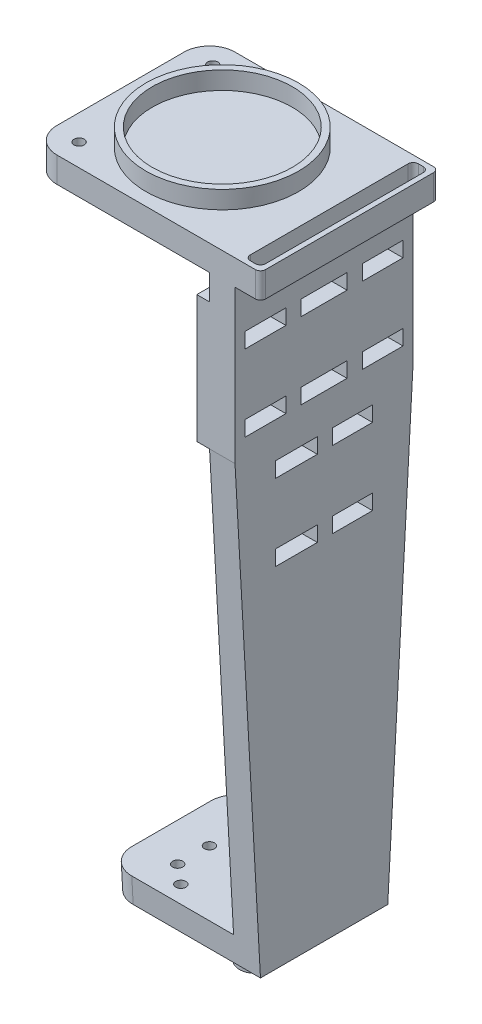
from build123d import *

# Parameters (mm, degrees)
SKETCH1_W                 = 80
SKETCH1_H                 = 70
BOSS_EXTRUDE1_DEPTH       = 10
SKETCH2_W                 = 10
SKETCH2_H                 = 70
BOSS_EXTRUDE2_DEPTH       = 450
SKETCH3_R                 = 30
SKETCH3_R_2               = 27.5
BOSS_EXTRUDE3_DEPTH       = 7
SKETCH6_R                 = 2
CUT_EXTRUDE3_DEPTH        = 27
SKETCH7_W                 = 70
SKETCH7_H                 = 210
CUT_EXTRUDE4_DEPTH        = 27
CUT_EXTRUDE5_DEPTH        = 70
BOSS_EXTRUDE5_DEPTH       = 50
SKETCH12_R                = 10
SKETCH12_R_2              = 7.5
SKETCH12_R_3              = 2.5
BOSS_EXTRUDE6_DEPTH       = 25
SKETCH13_R                = 2
CUT_EXTRUDE6_DEPTH        = 25
SKETCH14_W                = 24
SKETCH14_H                = 50
SKETCH14_W_2              = 20
SKETCH14_H_2              = 46
BOSS_EXTRUDE7_DEPTH       = 5
SKETCH15_W                = 24
SKETCH15_H                = 50
SKETCH15_W_2              = 20
SKETCH15_H_2              = 46
BOSS_EXTRUDE8_DEPTH       = 5
SKETCH16_W                = 22
SKETCH16_H                = 2
BOSS_EXTRUDE9_DEPTH       = 5
SKETCH17_W                = 46
SKETCH17_H                = 50
SKETCH17_W_2              = 19.659007001
SKETCH17_H_2              = 46
SKETCH17_W_3              = 20.340992999
BOSS_EXTRUDE10_DEPTH      = 5
SKETCH18_W                = 16
SKETCH18_H                = 6
SKETCH18_W_2              = 18
CUT_EXTRUDE8_DEPTH        = 10
SKETCH19_W                = 15.659007001
SKETCH19_H                = 6
SKETCH19_W_2              = 16.340992999
CUT_EXTRUDE9_DEPTH        = 10
FILLET1_R                 = 10
FILLET2_R                 = 10
SKETCH20_W                = 70
SKETCH20_H                = 10
BOSS_EXTRUDE11_DEPTH      = 10
SKETCH21_W                = 6
SKETCH21_H                = 66
CUT_EXTRUDE10_DEPTH       = 10
FILLET3_R                 = 2
FILLET4_R                 = 2
FILLET5_R                 = 2
SKETCH23_W                = 25.167549862
SKETCH23_H                = 25.727851888
CUT_EXTRUDE12_DEPTH       = 116
SKETCH25_R                = 6.25
BOSS_EXTRUDE12_DEPTH      = 15
SKETCH26_W                = 12.5
SKETCH26_H                = 21
SKETCH26_H_2              = 4
BOSS_EXTRUDE13_DEPTH      = 10
SKETCH27_W                = 12.5
SKETCH27_H                = 5
BOSS_EXTRUDE15_DEPTH      = 12.5
FILLET8_R                 = 6.25
CUT_EXTRUDE14_DEPTH       = 52.5
CUT_EXTRUDE14_DEPTH_BACK  = 12.5
SKETCH29_R                = 2.5
FILLET9_R                 = 6.25
SKETCH30_W                = 23.435939186
SKETCH30_H                = 31.122826337
CUT_EXTRUDE15_DEPTH       = 78
BOSS_EXTRUDE16_DEPTH      = 8
BOSS_EXTRUDE16_DEPTH_BACK = 12
SKETCH31_R                = 6.25
SKETCH32_R                = 5
CUT_EXTRUDE16_DEPTH       = 20
SKETCH33_R                = 2.5
BOSS_EXTRUDE17_DEPTH      = 20


# Some blends are built 0.0001 mm under size
with BuildPart() as part:
    # Sketch1 → Boss-Extrude1 (new body)
    with BuildSketch(Plane(origin=(0, 0, 0), x_dir=(1, 0, 0), z_dir=(0, 1, 0))):
        with Locations((-40, -35)):
            Rectangle(SKETCH1_W, SKETCH1_H)
    extrude(amount=BOSS_EXTRUDE1_DEPTH)

    # Sketch2 → Boss-Extrude2 (add)
    with BuildSketch(Plane.XZ):
        with Locations((-5, 35)):
            Rectangle(SKETCH2_W, SKETCH2_H)
    extrude(amount=BOSS_EXTRUDE2_DEPTH)

    # Sketch3 → Boss-Extrude3 (add)
    with BuildSketch(Plane(origin=(0, 10, 0), x_dir=(1, 0, 0), z_dir=(0, 1, 0))):
        with Locations(Location((-40, -35, 0), (0, 0, 90))):
            Circle(SKETCH3_R)
        with Locations(Location((-40, -35, 0), (0, 0, 270))):
            Circle(SKETCH3_R_2, mode=Mode.SUBTRACT)
    extrude(amount=BOSS_EXTRUDE3_DEPTH)

    # Sketch6 → Cut-Extrude3 (cut)
    with BuildSketch(Plane(origin=(0, 10, 0), x_dir=(1, 0, 0), z_dir=(0, 1, 0))):
        with Locations(Location((-70, -61.25, 0), (0, 0, 270))):
            Circle(SKETCH6_R)
        with Locations(Location((-70, -8.75, 0), (0, 0, 270))):
            Circle(SKETCH6_R)
    extrude(amount=-CUT_EXTRUDE3_DEPTH, mode=Mode.SUBTRACT)

    # Sketch7 → Cut-Extrude4 (cut)
    with BuildSketch(Plane.ZY.offset(10)):
        with Locations((35, -345)):
            Rectangle(SKETCH7_W, SKETCH7_H)
    extrude(amount=-CUT_EXTRUDE4_DEPTH, mode=Mode.SUBTRACT)

    # Sketch10 → Cut-Extrude5 (cut)
    with BuildSketch(Plane.ZY.offset(10)):
        Polygon((0, -60), (10, -240), (0, -240), align=None)
        Polygon((70, -60), (60, -240), (70, -240), align=None)
    extrude(amount=-CUT_EXTRUDE5_DEPTH, mode=Mode.SUBTRACT)

    # Sketch11 → Boss-Extrude5 (add)
    with BuildSketch(Plane.ZY.offset(10)):
        Polygon((10.116578541, -240), (60, -240), (60.555555556, -230), (9.444444444, -230), align=None)
    extrude(amount=BOSS_EXTRUDE5_DEPTH)

    # Sketch12 → Boss-Extrude6 (add)
    # profile 1 of 2: a face of its own
    with BuildSketch(Plane.XZ.offset(240)):
        with Locations(Location((-30, 35, 0), (0, 0, 90))):
            Circle(SKETCH12_R)
        with Locations(Location((-30, 35, 0), (0, 0, 270))):
            Circle(SKETCH12_R_2, mode=Mode.SUBTRACT)
    # profile 2 of 2: a face of its own
    with BuildSketch(Plane.XZ.offset(240)):
        with Locations(Location((-30, 35, 0), (0, 0, 90))):
            Circle(SKETCH12_R_3)
    extrude(amount=BOSS_EXTRUDE6_DEPTH)

    # Sketch13 → Cut-Extrude6 (cut)
    with BuildSketch(Plane(origin=(0, -240, 0), x_dir=(-1, 0, 0), z_dir=(0, -1, 0))):
        with Locations(Location((45, -47.529144635, 0), (0, 0, 90))):
            Circle(SKETCH13_R)
        with Locations(Location((45, -22.558289271, 0), (0, 0, 90))):
            Circle(SKETCH13_R)
        with Locations(Location((45, -35.043716953, 0), (0, 0, 90))):
            Circle(SKETCH13_R)
        with Locations(Location((37.5, -53.764572318, 0), (0, 0, 90))):
            Circle(SKETCH13_R)
        with Locations(Location((37.5, -16.308289271, 0), (0, 0, 90))):
            Circle(SKETCH13_R)
    extrude(amount=-CUT_EXTRUDE6_DEPTH, mode=Mode.SUBTRACT)

    # Sketch14 → Boss-Extrude7 (add)
    with BuildSketch(Plane.ZY.offset(10)):
        with Locations((12, -35)):
            Rectangle(SKETCH14_W, SKETCH14_H)
        with Locations((12, -35)):
            Rectangle(SKETCH14_W_2, SKETCH14_H_2, mode=Mode.SUBTRACT)
    extrude(amount=BOSS_EXTRUDE7_DEPTH)

    # Sketch15 → Boss-Extrude8 (add)
    with BuildSketch(Plane.ZY.offset(10)):
        with Locations((58, -35)):
            Rectangle(SKETCH15_W, SKETCH15_H)
        with Locations((58, -35)):
            Rectangle(SKETCH15_W_2, SKETCH15_H_2, mode=Mode.SUBTRACT)
    extrude(amount=BOSS_EXTRUDE8_DEPTH)

    # Sketch16 → Boss-Extrude9 (add)
    with BuildSketch(Plane.ZY.offset(10)):
        with Locations((35, -11)):
            Rectangle(SKETCH16_W, SKETCH16_H)
        with Locations((35, -59)):
            Rectangle(SKETCH16_W, SKETCH16_H)
    extrude(amount=BOSS_EXTRUDE9_DEPTH)

    # Sketch17 → Boss-Extrude10 (add)
    with BuildSketch(Plane.ZY.offset(10)):
        with Locations((35, -85)):
            Rectangle(SKETCH17_W, SKETCH17_H)
        with Locations((23.8295035, -85)):
            Rectangle(SKETCH17_W_2, SKETCH17_H_2, mode=Mode.SUBTRACT)
        with Locations((45.8295035, -85)):
            Rectangle(SKETCH17_W_3, SKETCH17_H_2, mode=Mode.SUBTRACT)
    extrude(amount=BOSS_EXTRUDE10_DEPTH)

    # Sketch18 → Cut-Extrude8 (cut)
    with BuildSketch(Plane.ZY.offset(10)):
        with Locations((12, -20)):
            Rectangle(SKETCH18_W, SKETCH18_H)
        with Locations((35, -20)):
            Rectangle(SKETCH18_W_2, SKETCH18_H)
        with Locations((58, -20)):
            Rectangle(SKETCH18_W, SKETCH18_H)
        with Locations((12, -50)):
            Rectangle(SKETCH18_W, SKETCH18_H)
        with Locations((35, -50)):
            Rectangle(SKETCH18_W_2, SKETCH18_H)
        with Locations((58, -50)):
            Rectangle(SKETCH18_W, SKETCH18_H)
    extrude(amount=-CUT_EXTRUDE8_DEPTH, mode=Mode.SUBTRACT)

    # Sketch19 → Cut-Extrude9 (cut)
    with BuildSketch(Plane.ZY.offset(10)):
        with Locations((23.829503501, -70)):
            Rectangle(SKETCH19_W, SKETCH19_H)
        with Locations((23.829503501, -100)):
            Rectangle(SKETCH19_W, SKETCH19_H)
        with Locations((45.8295035, -70)):
            Rectangle(SKETCH19_W_2, SKETCH19_H)
        with Locations((45.8295035, -100)):
            Rectangle(SKETCH19_W_2, SKETCH19_H)
    extrude(amount=-CUT_EXTRUDE9_DEPTH, mode=Mode.SUBTRACT)

    # Fillet1
    fillet1_edges = [part.edges().sort_by_distance(p)[0] for p in [
        (-80, 5, 0),
        (-80, 5, 70),
    ]]
    fillet(fillet1_edges, radius=FILLET1_R)

    # Fillet2
    fillet2_edges = [part.edges().sort_by_distance(p)[0] for p in [
        (-60, -235, 9.780511493),
        (-60, -235, 60.277777778),
    ]]
    fillet(fillet2_edges, radius=FILLET2_R)

    # Sketch20 → Boss-Extrude11 (add)
    with BuildSketch(Plane(origin=(0, 0, 0), x_dir=(0, 0, -1), z_dir=(1, 0, 0))):
        with Locations((-35, 5)):
            Rectangle(SKETCH20_W, SKETCH20_H)
    extrude(amount=BOSS_EXTRUDE11_DEPTH)

    # Sketch21 → Cut-Extrude10 (cut)
    with BuildSketch(Plane.XZ):
        with Locations((5, 35)):
            Rectangle(SKETCH21_W, SKETCH21_H)
    extrude(amount=-CUT_EXTRUDE10_DEPTH, mode=Mode.SUBTRACT)

    # Fillet3
    fillet3_edges = [part.edges().sort_by_distance(p)[0] for p in [
        (10, 5, 70),
        (10, 5, 0),
    ]]
    fillet(fillet3_edges, radius=FILLET3_R)

    # Fillet4
    fillet4_edges = [part.edges().sort_by_distance(p)[0] for p in [
        (8, 5, 68),
        (8, 5, 2),
    ]]
    fillet(fillet4_edges, radius=FILLET4_R)

    # Fillet5
    fillet5_edges = [part.edges().sort_by_distance(p)[0] for p in [
        (2, 5, 2),
        (2, 5, 68),
    ]]
    fillet(fillet5_edges, radius=FILLET5_R)

    # Sketch23 → Cut-Extrude12 (cut)
    with BuildSketch(Plane.XZ.offset(240)):
        with Locations((-28.923795104, 37.128742303)):
            Rectangle(SKETCH23_W, SKETCH23_H)
    extrude(amount=CUT_EXTRUDE12_DEPTH, mode=Mode.SUBTRACT)

    # Sketch25 → Boss-Extrude12 (add)
    with BuildSketch(Plane(origin=(0, -240, 0), x_dir=(-1, 0, 0), z_dir=(0, -1, 0))):
        with Locations(Location((26.99513388, -35, 0), (0, 0, 270))):
            Circle(SKETCH25_R)
    extrude(amount=BOSS_EXTRUDE12_DEPTH)

    # Sketch26 → Boss-Extrude13 (add)
    with BuildSketch(Plane(origin=(0, -255, 0), x_dir=(-1, 0, 0), z_dir=(0, -1, 0))):
        with Locations((26.99513388, -45.5)):
            Rectangle(SKETCH26_W, SKETCH26_H)
        with Locations((26.99513388, -24.5)):
            Rectangle(SKETCH26_W, SKETCH26_H)
        with Locations((26.99513388, -12)):
            Rectangle(SKETCH26_W, SKETCH26_H_2)
        with Locations((26.99513388, -58)):
            Rectangle(SKETCH26_W, SKETCH26_H_2)
    extrude(amount=BOSS_EXTRUDE13_DEPTH)

    # Sketch27 → Boss-Extrude15 (add)
    with BuildSketch(Plane.XZ.offset(265)):
        with Locations((-26.99513388, 12.5)):
            Rectangle(SKETCH27_W, SKETCH27_H)
        with Locations((-26.99513388, 57.5)):
            Rectangle(SKETCH27_W, SKETCH27_H)
    extrude(amount=BOSS_EXTRUDE15_DEPTH)

    # Fillet8
    fillet8_edges = [part.edges().sort_by_distance(p)[0] for p in [
        (-20.74513388, -277.5, 57.5),
        (-33.24513388, -277.5, 57.5),
        (-20.74513388, -277.5, 12.5),
        (-33.24513388, -277.5, 12.5),
    ]]
    fillet(fillet8_edges, radius=FILLET8_R - 0.0001)  # a hair under: the kernel refuses the full size

    # Sketch29 → Cut-Extrude14 (cut, two sides: drawn at the far end of the back side and taken through both)
    with BuildSketch(Plane(origin=(0, 0, 55), x_dir=(-1, 0, 0), z_dir=(0, 0, -1)).offset(-CUT_EXTRUDE14_DEPTH_BACK)):
        with Locations(Location((26.99513388, -271.25, 0), (0, 0, 180))):
            Circle(SKETCH29_R)
    extrude(amount=CUT_EXTRUDE14_DEPTH + CUT_EXTRUDE14_DEPTH_BACK, mode=Mode.SUBTRACT)

    # Fillet9
    # the kernel refuses this fillet: 6.25 mm, written as the material it takes off along each edge
    with BuildSketch(Plane(origin=(-20.74513388, -255, 35), x_dir=(0, -1, 0), z_dir=(0, 0, 1))) as fillet9_piece_1_section:
        with BuildLine():
            CenterArc((FILLET9_R, -FILLET9_R), FILLET9_R, 90, 90)
            Line((0, -FILLET9_R), (0, 0))
            Line((0, 0), (FILLET9_R, 0))
        make_face()
    fillet9_piece_1 = extrude(amount=40.625, mode=Mode.PRIVATE)
    fillet9_piece_1 = fillet9_piece_1 - Plane(origin=(-26.99513388, -256.446444019, 35), x_dir=(0, 0, 1), z_dir=(0, 1, 0)) * Cylinder(6.25, 107, mode=Mode.PRIVATE)
    add(fillet9_piece_1, mode=Mode.SUBTRACT)
    with BuildSketch(Plane(origin=(-33.24513388, -255, 34.999999912), x_dir=(0, -1, 0), z_dir=(0, 0, 1))) as fillet9_piece_2_section:
        with BuildLine():
            CenterArc((FILLET9_R, FILLET9_R), FILLET9_R, 180, 90)
            Line((0, FILLET9_R), (0, 0))
            Line((0, 0), (FILLET9_R, 0))
        make_face()
    fillet9_piece_2 = extrude(amount=40.625000088, mode=Mode.PRIVATE)
    fillet9_piece_2 = fillet9_piece_2 - Plane(origin=(-26.99513388, -256.446444017, 35), x_dir=(0, 0, 1), z_dir=(0, 1, 0)) * Cylinder(6.25, 107, mode=Mode.PRIVATE)
    add(fillet9_piece_2, mode=Mode.SUBTRACT)
    with BuildSketch(Plane(origin=(-20.74513388, -255, -5.625), x_dir=(-1, 0, 0), z_dir=(0, 0, 1))) as fillet9_piece_3_section:
        with BuildLine():
            CenterArc((FILLET9_R, FILLET9_R), FILLET9_R, 180, 90)
            Line((0, FILLET9_R), (0, 0))
            Line((0, 0), (FILLET9_R, 0))
        make_face()
    fillet9_piece_3 = extrude(amount=40.625, mode=Mode.PRIVATE)
    fillet9_piece_3 = fillet9_piece_3 - Plane(origin=(-26.99513388, -256.446444019, 35), x_dir=(0, 0, 1), z_dir=(0, 1, 0)) * Cylinder(6.25, 107, mode=Mode.PRIVATE)
    add(fillet9_piece_3, mode=Mode.SUBTRACT)
    with BuildSketch(Plane(origin=(-33.24513388, -255, -5.625), x_dir=(0, -1, 0), z_dir=(0, 0, 1))) as fillet9_piece_4_section:
        with BuildLine():
            CenterArc((FILLET9_R, FILLET9_R), FILLET9_R, 180, 90)
            Line((0, FILLET9_R), (0, 0))
            Line((0, 0), (FILLET9_R, 0))
        make_face()
    fillet9_piece_4 = extrude(amount=40.624999912, mode=Mode.PRIVATE)
    fillet9_piece_4 = fillet9_piece_4 - Plane(origin=(-26.99513388, -256.446444019, 35), x_dir=(0, 0, 1), z_dir=(0, 1, 0)) * Cylinder(6.25, 107, mode=Mode.PRIVATE)
    add(fillet9_piece_4, mode=Mode.SUBTRACT)

    # Sketch30 → Cut-Extrude15 (cut)
    with BuildSketch(Plane(origin=(0, 0, 10), x_dir=(-1, 0, 0), z_dir=(0, 0, -1))):
        with Locations((26.442215429, -267.57880534)):
            Rectangle(SKETCH30_W, SKETCH30_H)
    extrude(amount=-CUT_EXTRUDE15_DEPTH, mode=Mode.SUBTRACT)

    # Sketch31 → Boss-Extrude16 (add, two sides: drawn at the far end of the back side and taken through both)
    with BuildSketch(Plane.XZ.offset(252.017392171).offset(-BOSS_EXTRUDE16_DEPTH_BACK)):
        with Locations(Location((-26.99513388, 35, 0), (0, 0, 90))):
            Circle(SKETCH31_R)
    extrude(amount=BOSS_EXTRUDE16_DEPTH + BOSS_EXTRUDE16_DEPTH_BACK)

    # Sketch32 → Cut-Extrude16 (cut)
    with BuildSketch(Plane(origin=(0, -260.017392171, 0), x_dir=(-1, 0, 0), z_dir=(0, -1, 0))):
        with Locations(Location((26.99513388, -35, 0), (0, 0, 90))):
            Circle(SKETCH32_R)
    extrude(amount=-CUT_EXTRUDE16_DEPTH, mode=Mode.SUBTRACT)

    # Sketch33 → Boss-Extrude17 (add)
    with BuildSketch(Plane.XZ.offset(240.017392171)):
        with Locations(Location((-26.99513388, 35, 0), (0, 0, 270))):
            Circle(SKETCH33_R)
    extrude(amount=BOSS_EXTRUDE17_DEPTH)


solid = part.part
